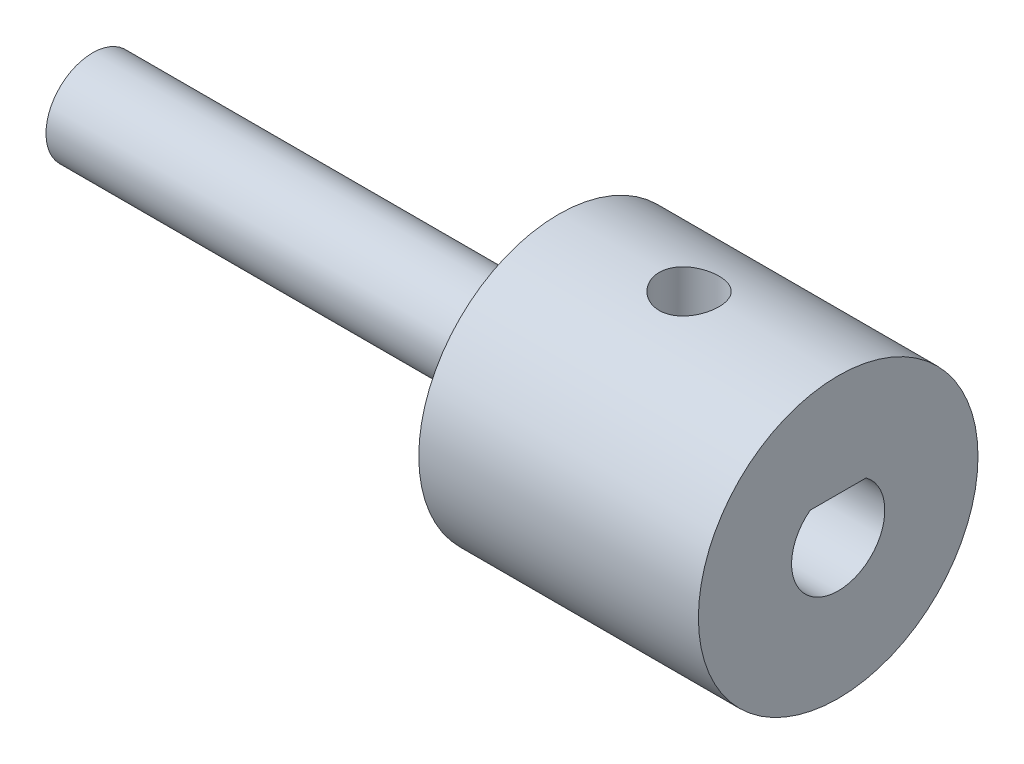
from build123d import *

# Parameters (mm, degrees)
CUT_EXTRUDE1_START = -10
CUT_EXTRUDE1_DEPTH = 10
SKETCH5_R          = 1.6
CUT_EXTRUDE2_DEPTH = 11


with BuildPart() as part:
    # Sketch2 → Revolve1 (revolve)
    with BuildSketch(Plane.XY):
        Polygon((15, 0), (15, 7.5), (0, 7.5), (0, 2.5), (-25, 2.5), (-25, 0), align=None)
    revolve(axis=Axis((15, 0, 0), (-1, 0, 0)))

    # Sketch3 → Cut-Extrude1 (cut)
    with BuildSketch(Plane(origin=(15, 0, 0), x_dir=(0, 0, -1), z_dir=(1, 0, 0)).offset(CUT_EXTRUDE1_START)):
        with BuildLine():
            Line((-1.5, 2), (1.5, 2))
            ThreePointArc((1.5, 2), (0, -2.5), (-1.5, 2))
        make_face()
    extrude(amount=CUT_EXTRUDE1_DEPTH, mode=Mode.SUBTRACT)

    # Sketch5 → Cut-Extrude2 (cut)
    with BuildSketch(Plane(origin=(0, 0, 0), x_dir=(1, 0, 0), z_dir=(0, 1, 0))):
        with Locations((7, 0)):
            Circle(SKETCH5_R)
    extrude(amount=CUT_EXTRUDE2_DEPTH, mode=Mode.SUBTRACT)


solid = part.part
